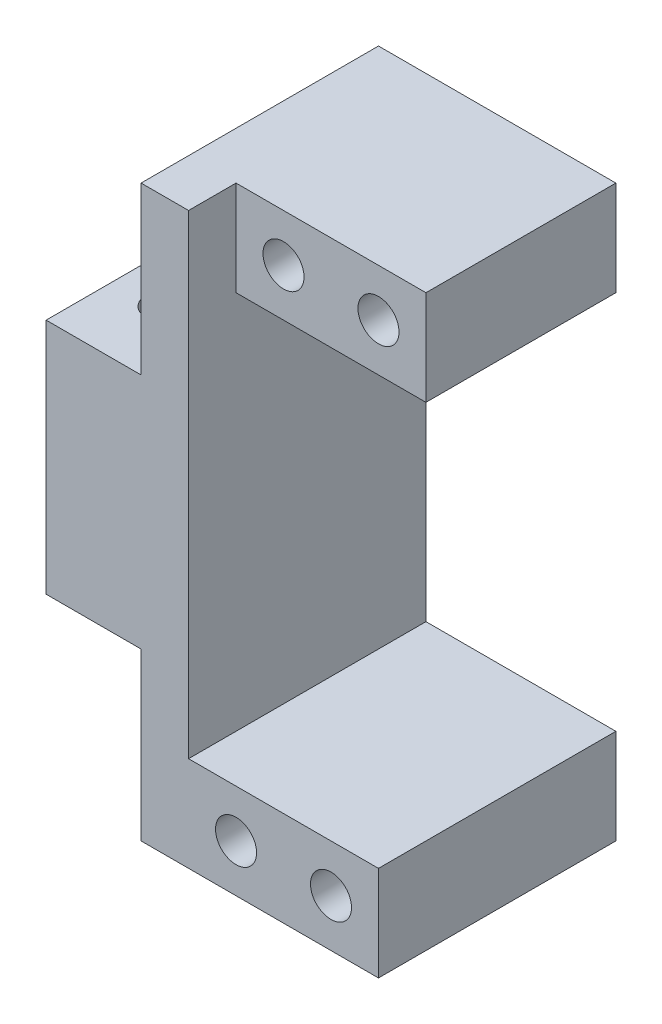
from build123d import *

# Parameters (mm, degrees)
EXTRUSION1_DEPTH        = 25
ESQUISSE2_R             = 2
ENL_V_MAT_EXTRU_1_DEPTH = 61.466933112
ESQUISSE3_R             = 2.161398555
ENL_V_MAT_EXTRU_2_DEPTH = 53.440442409
ESQUISSE4_W             = 20
ESQUISSE4_H             = 10
ENL_V_MAT_EXTRU_3_DEPTH = 5


with BuildPart() as part:
    # Esquisse1 → Extrusion1 (new body)
    with BuildSketch(Plane.XY):
        Polygon((0, -12.5), (0, 12.5), (10, 12.5), (10, 30), (35, 30), (35, 20), (15, 20), (15, -20), (35, -20), (35, -30), (10, -30), (10, -12.5), align=None)
    extrude(amount=EXTRUSION1_DEPTH)

    # Esquisse2 → Enlèv. mat.-Extru.1 (cut, through all)
    with BuildSketch(Plane(origin=(0, 12.5, 0), x_dir=(1, 0, 0), z_dir=(0, 1, 0))):
        with Locations((5, -7.5)):
            Circle(ESQUISSE2_R)
        with Locations((5, -17.5)):
            Circle(ESQUISSE2_R)
    extrude(amount=-ENL_V_MAT_EXTRU_1_DEPTH, mode=Mode.SUBTRACT)

    # Esquisse3 → Enlèv. mat.-Extru.2 (cut, through all)
    with BuildSketch(Plane.XY.offset(25)):
        with Locations((30, 25)):
            Circle(ESQUISSE3_R)
        with Locations((20, 25)):
            Circle(ESQUISSE3_R)
        with Locations((20, -25)):
            Circle(ESQUISSE3_R)
        with Locations((30, -25)):
            Circle(ESQUISSE3_R)
    extrude(amount=-ENL_V_MAT_EXTRU_2_DEPTH, mode=Mode.SUBTRACT)

    # Esquisse4 → Enlèv. mat.-Extru.3 (cut)
    with BuildSketch(Plane.XY.offset(25)):
        with Locations((25, 25)):
            Rectangle(ESQUISSE4_W, ESQUISSE4_H)
    extrude(amount=-ENL_V_MAT_EXTRU_3_DEPTH, mode=Mode.SUBTRACT)


solid = part.part
